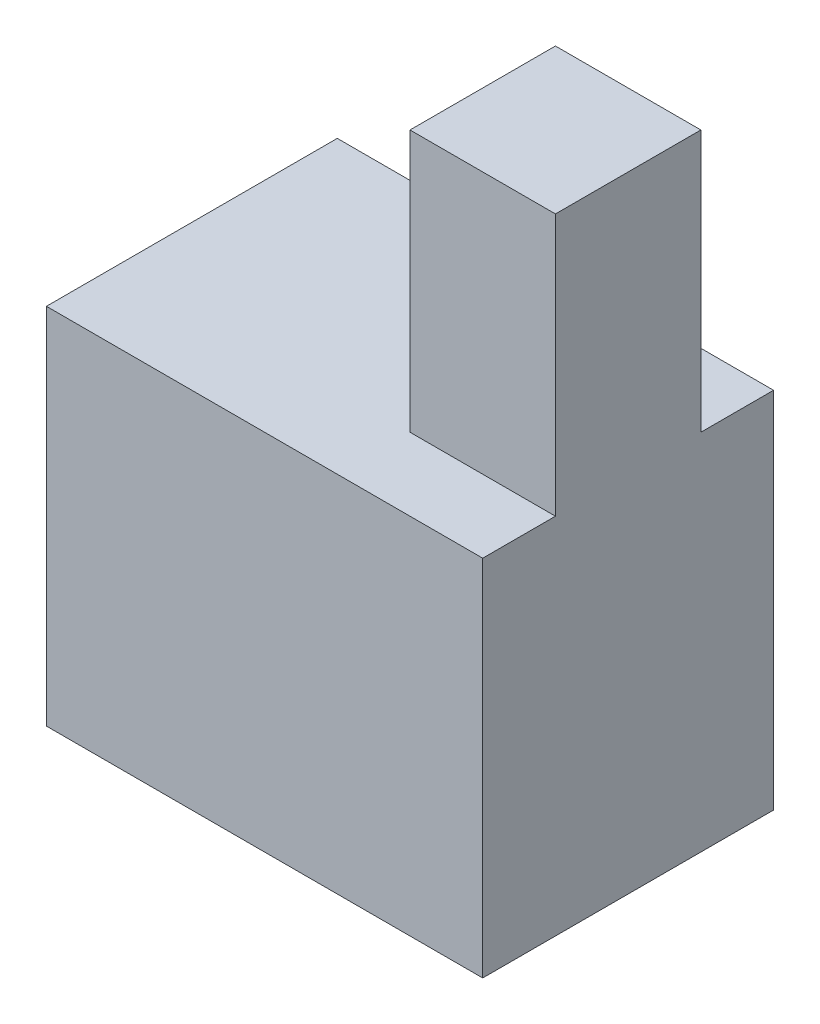
from build123d import *

# Parameters (mm, degrees)
BOSS_EXTRUDE3_DEPTH = 10
SKETCH5_W           = 30
SKETCH5_H           = 25
BOSS_EXTRUDE5_DEPTH = 5
BOSS_EXTRUDE7_DEPTH = 5


with BuildPart() as part:
    # Sketch3 → Boss-Extrude3 (new body)
    with BuildSketch(Plane.XY):
        Polygon((0, 0), (0, -5), (20, -5), (20, -25), (30, -25), (30, 18), (20, 18), (20, 0), align=None)
    extrude(amount=BOSS_EXTRUDE3_DEPTH)

    # Sketch5 → Boss-Extrude5 (add)
    with BuildSketch(Plane.XY.offset(10)):
        with Locations((15, -12.5)):
            Rectangle(SKETCH5_W, SKETCH5_H)
    extrude(amount=BOSS_EXTRUDE5_DEPTH)

    # Sketch7 → Boss-Extrude7 (add)
    with BuildSketch(Plane(origin=(0, 0, 0), x_dir=(-1, 0, 0), z_dir=(0, 0, -1))):
        Polygon((0, 0), (-20, 0), (-20.758888401, 0), (-30, 0), (-30, -25), (-20, -25), (-20, -5), (0, -5), align=None)
    extrude(amount=BOSS_EXTRUDE7_DEPTH)


solid = part.part
